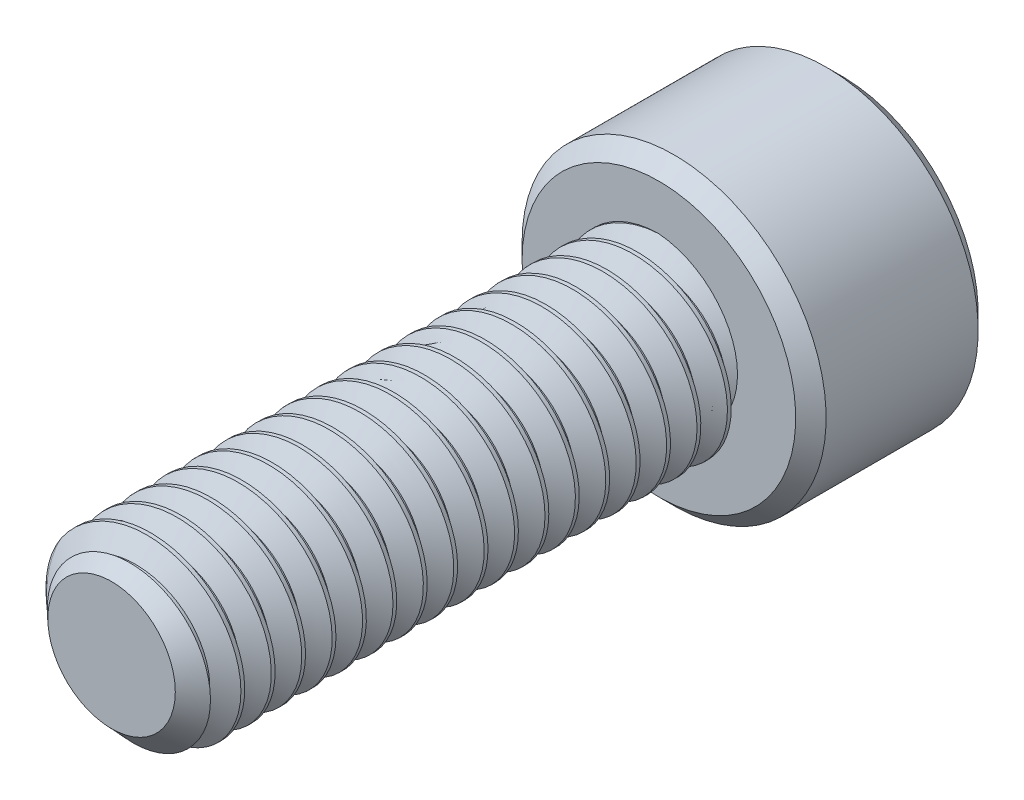
from build123d import *

# Parameters (mm, degrees)
SKETCH1_R          = 3
EXTRUDE1_DEPTH     = 18
CUT_SWEEP1_PITCH   = 1
SKETCH6_R          = 5
EXTRUDE2_DEPTH     = 6
CUT_EXTRUDE1_DEPTH = 3.75
CHAMFER1_SIZE      = 0.5


with BuildPart() as part:
    # Sketch1 → Extrude1 (new body)
    with BuildSketch(Plane.XY):
        Circle(SKETCH1_R)
    extrude(amount=-EXTRUDE1_DEPTH)

    # Cut-Sweep1: the profile of Sketch3 profile screwed along a right-hand helix of 19 turns, 6 arcs to a turn; built about Z, then put on its axis
    cut_sweep1_z = Axis((0, 0, 0), (0, 0, 1))
    cut_sweep1_corners = [(3.0003, 0, -0.875173205), (2.350480947, 0, -0.5), (2.350480947, 0, -0.375), (3.0003, 0, 0.000173205)]
    with BuildLine(mode=Mode.PRIVATE) as cut_sweep1_profile:
        Line(cut_sweep1_corners[0], cut_sweep1_corners[1])
        Line(cut_sweep1_corners[1], cut_sweep1_corners[2])
        Line(cut_sweep1_corners[2], cut_sweep1_corners[3])
        Line(cut_sweep1_corners[3], cut_sweep1_corners[0])
    cut_sweep1_cap = Face(cut_sweep1_profile.wire())
    cut_sweep1_turn_angles = [0, 30, 60, 90, 120, 150, 180, 210, 240, 270, 300, 330, 360]
    cut_sweep1_turn_weights = [1, 0.8660254037844387, 1, 0.8660254037844387, 1, 0.8660254037844387, 1, 0.8660254037844387, 1, 0.8660254037844387, 1, 0.8660254037844387, 1]
    cut_sweep1_turn_rails = [Edge.make_bspline([Vector(p[0], p[1], 0).rotate(cut_sweep1_z, cut_sweep1_turn_angles[k]) / cut_sweep1_turn_weights[k] + Vector(0, 0, p[2] + CUT_SWEEP1_PITCH * cut_sweep1_turn_angles[k] / 360) for k in range(13)], [0, 0, 0, 1, 1, 2, 2, 3, 3, 4, 4, 5, 5, 6, 6, 6], 2, cut_sweep1_turn_weights) for p in cut_sweep1_corners]
    cut_sweep1_turn_sides = [Face.make_surface_from_curves(cut_sweep1_turn_rails[p[0]], cut_sweep1_turn_rails[p[1]]) for p in [(0, 1), (1, 2), (2, 3), (3, 0)]]
    cut_sweep1 = Plane(origin=(0, 0, 0), x_dir=(0, 1, 0), z_dir=(0, 0, -1)) * Solid(Shell([*[p.moved(Location((0, 0, CUT_SWEEP1_PITCH * i))) for i in range(19) for p in cut_sweep1_turn_sides], cut_sweep1_cap, cut_sweep1_cap.rotate(cut_sweep1_z, 6840).moved(Location((0, 0, CUT_SWEEP1_PITCH * 6840 / 360)))]))
    add(cut_sweep1, mode=Mode.SUBTRACT)

    # Sketch4 → Cut-Revolve1 (revolve, cut)
    with BuildSketch(Plane(origin=(0, 0, 0), x_dir=(0, 0, -1), z_dir=(1, 0, 0)), mode=Mode.PRIVATE) as cut_revolve1_sk:
        Polygon((0.842545147, 3), (0, 2.096480947), (0, 3), align=None)
    revolve(cut_revolve1_sk.sketch.rotate(Axis((0, 0, 0), (0, 0, -1)), 265.477705154), axis=Axis((0, 0, 0), (0, 0, -1)), mode=Mode.SUBTRACT)

    # Sketch6 → Extrude2 (add)
    with BuildSketch(Plane(origin=(0, 0, -18), x_dir=(-1, 0, 0), z_dir=(0, 0, -1))):
        Circle(SKETCH6_R)
    extrude(amount=EXTRUDE2_DEPTH)

    # Sketch7 → Cut-Extrude1 (cut)
    with BuildSketch(Plane(origin=(0, 0, -24), x_dir=(-1, 0, 0), z_dir=(0, 0, -1))):
        Polygon((0, 2.886751346), (-2.5, 1.443375673), (-2.5, -1.443375673), (0, -2.886751346), (2.5, -1.443375673), (2.5, 1.443375673), align=None)
    extrude(amount=-CUT_EXTRUDE1_DEPTH, mode=Mode.SUBTRACT)

    # Cut-Extrude2 cone 1 section (through the dimple's axis) → Cut-Extrude2 (revolve, cut)
    with BuildSketch(Plane(origin=(0, 0, -24), x_dir=(0, 1, 0), z_dir=(1, 0, 0))):
        Polygon((0, 0), (2.886751346, 0), (0, 2.886751346), align=None)
    revolve(axis=Axis((0, 0, -24), (0, 0, 1)), mode=Mode.SUBTRACT)

    # Chamfer1
    chamfer1_edges = [part.edges().sort_by_distance(p)[0] for p in [
        (5, 0, -18),
        (5, 0, -24),
    ]]
    chamfer(chamfer1_edges, length=CHAMFER1_SIZE)


solid = part.part
